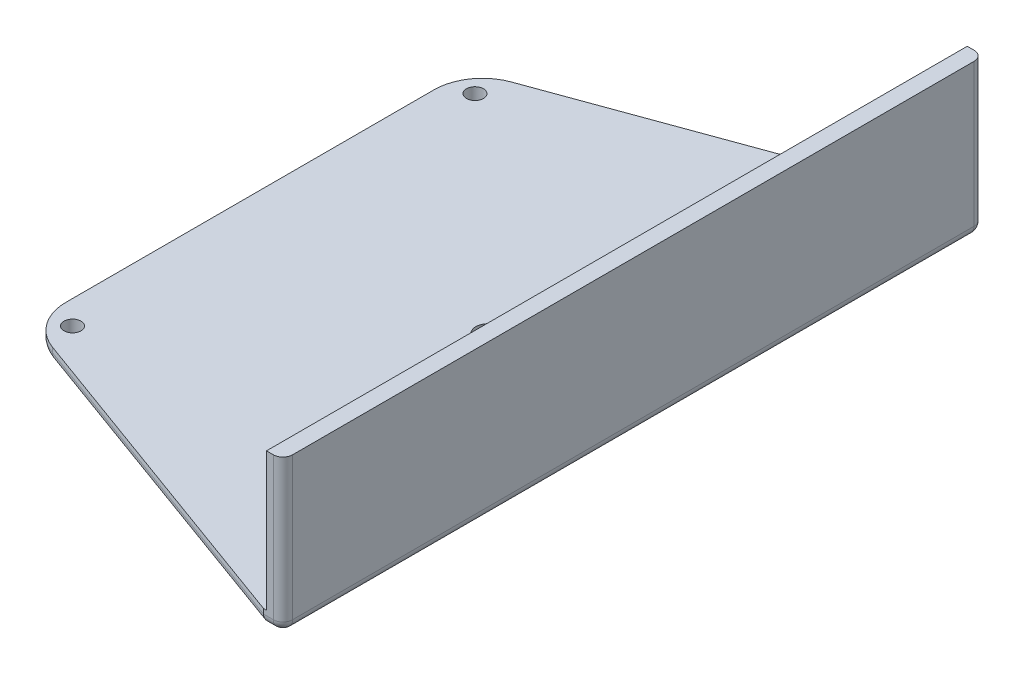
from build123d import *

# Parameters (mm, degrees)
BOSS_EXTRUDE1_DEPTH     = 3
SKETCH2_W               = 3.3999999999999995
SKETCH2_H               = 144.72
BOSS_EXTRUDE2_DEPTH     = 31.5
SKETCH3_R               = 1.749999999999997
CUT_EXTRUDE1_DEPTH      = 40
FILLET1_R               = 2
FILLET2_R               = 2
CONG_1_R                = 10
ESQUISSE2_R             = 2.500000000000002
ENL_V_MAT_EXTRU_1_DEPTH = 10


with BuildPart() as part:
    # Sketch1 → Boss-Extrude1 (new body)
    with BuildSketch(Plane(origin=(0, 0, 0), x_dir=(1, 0, 0), z_dir=(0, 1, 0))):
        Polygon((-79.17599616899001, 45), (-79.17599616899001, -45), (-4, -72.36), (0, -72.36), (0, 72.36), (-4, 72.36), align=None)
    extrude(amount=BOSS_EXTRUDE1_DEPTH)

    # Sketch2 → Boss-Extrude2 (add)
    with BuildSketch(Plane.XZ):
        with Locations((-1.6999999999999997, 0)):
            Rectangle(SKETCH2_W, SKETCH2_H)
    extrude(amount=-BOSS_EXTRUDE2_DEPTH)

    # Sketch3 → Cut-Extrude1 (cut)
    with BuildSketch(Plane(origin=(0, 3, 0), x_dir=(1, 0, 0), z_dir=(0, 1, 0))):
        with Locations(Location((-74.2610839032561, -41.5585413818937, 0), (0, 0, 270))):
            Circle(SKETCH3_R)
        with Locations(Location((-74.26108390325611, 41.55854138189368, 0), (0, 0, 270))):
            Circle(SKETCH3_R)
    extrude(amount=-CUT_EXTRUDE1_DEPTH, mode=Mode.SUBTRACT)

    # Fillet1
    fillet1_edges = [part.edges().sort_by_distance(p)[0] for p in [
        (-2, 0, -72.36),
        (0, 0, 0),
        (-2, 0, 72.36),
        (-41.587998084495005, 0, 58.68),
        (-79.17599616899001, 0, 0),
        (-41.587998084495005, 0, -58.68),
    ]]
    fillet(fillet1_edges, radius=FILLET1_R)

    # Fillet2
    # the kernel refuses this fillet: 2 mm, written as the material it takes off along each edge
    with BuildSketch(Plane(origin=(-2, 2, -70.36), x_dir=(1, 0, 0), z_dir=(0, 0, -1))) as fillet2_piece_1_section:
        Polygon((0, 0), (FILLET2_R, 0), (FILLET2_R, FILLET2_R), (0, FILLET2_R), align=None)
    fillet2_piece_1 = extrude(amount=FILLET2_R, mode=Mode.PRIVATE)
    fillet2_piece_1 = fillet2_piece_1 - Plane(origin=(-2, 2, -70.36), x_dir=(-0.7071067811865475, 0.7071067811865475, 0), z_dir=(0, 0, -1)) * Sphere(FILLET2_R, mode=Mode.PRIVATE)
    add(fillet2_piece_1, mode=Mode.SUBTRACT)
    with BuildSketch(Plane(origin=(-2, 2, 70.36), x_dir=(1, 0, 0), z_dir=(0, 0, 1))) as fillet2_piece_2_section:
        Polygon((0, 0), (FILLET2_R, 0), (FILLET2_R, -FILLET2_R), (0, -FILLET2_R), align=None)
    fillet2_piece_2 = extrude(amount=FILLET2_R, mode=Mode.PRIVATE)
    fillet2_piece_2 = fillet2_piece_2 - Plane(origin=(-2, 2, 70.36), x_dir=(-0.7071067811865475, 0.7071067811865475, 0), z_dir=(0, 0, 1)) * Sphere(FILLET2_R, mode=Mode.PRIVATE)
    add(fillet2_piece_2, mode=Mode.SUBTRACT)
    with BuildSketch(Plane(origin=(0, 36.5, -72.36), x_dir=(-1, 0, 0), z_dir=(0, -1, 0))) as fillet2_piece_3:
        with BuildLine():
            CenterArc((FILLET2_R, -FILLET2_R), FILLET2_R, 90, 90)
            Line((-2.2e-16, -FILLET2_R), (0, 0))
            Line((0, 0), (FILLET2_R, 0))
        make_face()
    extrude(amount=34.5, mode=Mode.SUBTRACT)
    with BuildSketch(Plane(origin=(0, 1.9999999999999993, 72.36), x_dir=(-1, 0, 0), z_dir=(0, 1, 0))) as fillet2_piece_4:
        with BuildLine():
            CenterArc((FILLET2_R, -FILLET2_R), FILLET2_R, 90, 90)
            Line((0, -FILLET2_R), (0, 0))
            Line((0, 0), (FILLET2_R, 0))
        make_face()
    extrude(amount=34.5, mode=Mode.SUBTRACT)

    # Congé1
    # the kernel refuses this fillet: 10 mm, written as the material it takes off along each edge
    with BuildSketch(Plane(origin=(-69.17599616899001, 0, -37.99776488738916), x_dir=(-1, 0, 0), z_dir=(0, 0, 1))) as cong_1_piece_1:
        with BuildLine():
            CenterArc((8, -2), 2, 0, 90)
            Line((10, -2), (10, 0))
            Line((10, 0), (8, 0))
        make_face()
    revolve(axis=Axis((-69.17599616899001, 0, -37.99776488738916), (0, -1, 0)), revolution_arc=70.00122819209012, mode=Mode.SUBTRACT)
    with BuildSketch(Plane(origin=(-69.17599616899001, 0, 37.99776488738917), x_dir=(-0.34199999999999997, 0, 0.9396999521123751), z_dir=(0.9396999521123751, 0, 0.34199999999999997))) as cong_1_piece_2:
        with BuildLine():
            CenterArc((8, -2), 2, 0, 90)
            Line((10, -2), (10, 0))
            Line((10, 0), (8, 0))
        make_face()
    revolve(axis=Axis((-69.17599616899001, 0, 37.99776488738917), (0, -1, 0)), revolution_arc=70.00122819209012, mode=Mode.SUBTRACT)
    with BuildSketch(Plane(origin=(-79.17599616899001, -4.4e-16, 45), x_dir=(0, 0, -1), z_dir=(0, 1, 0))) as cong_1_piece_3:
        with BuildLine():
            CenterArc((CONG_1_R * 0.700223511261, -CONG_1_R), CONG_1_R, 90, 70.00122819209011)
            Line((-CONG_1_R * 0.239476440851, -CONG_1_R * 0.658), (0, 0))
            Line((0, 0), (CONG_1_R * 0.700223511261, 0))
        make_face()
    extrude(amount=20.505587781527105, mode=Mode.SUBTRACT)
    with BuildSketch(Plane(origin=(-79.17599616899001, -4.4e-16, -45), x_dir=(0, 0, 1), z_dir=(0, 1, 0))) as cong_1_piece_4:
        with BuildLine():
            CenterArc((CONG_1_R * 0.700223511261, CONG_1_R), CONG_1_R, 199.99877180790997, 70.00122819209003)
            Line((-CONG_1_R * 0.239476440851, CONG_1_R * 0.658), (0, 0))
            Line((0, 0), (CONG_1_R * 0.700223511261, 0))
        make_face()
    extrude(amount=20.5055877815271, mode=Mode.SUBTRACT)

    # Esquisse2 → Enlèv. mat.-Extru.1 (cut)
    with BuildSketch(Plane.XZ):
        with Locations(Location((-30, -3.67e-15, 0), (0, 0, 270))):
            Circle(ESQUISSE2_R)
        Polygon((-10.25, 7.499999999999999), (-19.75, 7.499999999999999), (-19.749999999999996, -7.500000000000002), (-10.249999999999998, -7.500000000000001), align=None)
    extrude(amount=-ENL_V_MAT_EXTRU_1_DEPTH, mode=Mode.SUBTRACT)


solid = part.part
